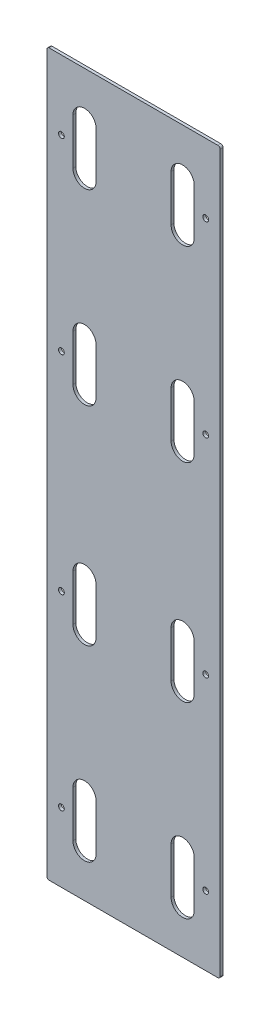
from build123d import *

# Parameters (mm, degrees)
SKETCH1_W                   = 190.5
SKETCH1_H                   = 793.115
BOSS_EXTRUDE1_DEPTH         = 3.175
F_1_4_0_25_DIAMETER_HOLE1_D = 6.35
F_1_1_DIAMETER_SLOT1_DEPTH  = 3.175
FILLET1_R                   = 2.54


# Read off the part's stored shape, not the designer's step: 1 (1) Diameter Slot1
with BuildPart() as part:
    # Sketch1 → Boss-Extrude1 (new body)
    with BuildSketch(Plane.XY):
        with Locations((95.25, 396.5575)):
            Rectangle(SKETCH1_W, SKETCH1_H)
    extrude(amount=BOSS_EXTRUDE1_DEPTH)

    # 1/4 (0.25) Diameter Hole1 (through all)
    with Locations(Plane.XY.offset(3.175)):
        with Locations((15.875, 716.915), (15.875, 510.8575), (15.875, 282.2575), (15.875, 76.2), (174.625, 76.2), (174.625, 282.2575), (174.625, 510.8575), (174.625, 716.915)):
            Hole(F_1_4_0_25_DIAMETER_HOLE1_D / 2)

    # 1 (1) Diameter Slot1 outline → 1 (1) Diameter Slot1 (cut)
    with BuildSketch(Plane.XY):
        with BuildLine():
            Line((161.925, 691.515), (161.925, 742.315))
            ThreePointArc((161.925, 742.315), (149.225, 755.015), (136.525, 742.315))
            Line((136.525, 742.315), (136.525, 691.515))
            ThreePointArc((136.525, 691.515), (149.225, 678.815), (161.925, 691.515))
        make_face()
        with BuildLine():
            ThreePointArc((161.925, 536.2575), (149.225, 548.9575), (136.525, 536.2575))
            Line((136.525, 536.2575), (136.525, 485.4575))
            ThreePointArc((136.525, 485.4575), (149.225, 472.7575), (161.925, 485.4575))
            Line((161.925, 485.4575), (161.925, 536.2575))
        make_face()
        with BuildLine():
            ThreePointArc((161.925, 307.6575), (149.225, 320.3575), (136.525, 307.6575))
            Line((136.525, 307.6575), (136.525, 256.8575))
            ThreePointArc((136.525, 256.8575), (149.225, 244.1575), (161.925, 256.8575))
            Line((161.925, 256.8575), (161.925, 307.6575))
        make_face()
        with BuildLine():
            ThreePointArc((161.925, 101.6), (149.225, 114.3), (136.525, 101.6))
            Line((136.525, 101.6), (136.525, 50.8))
            ThreePointArc((136.525, 50.8), (149.225, 38.1), (161.925, 50.8))
            Line((161.925, 50.8), (161.925, 101.6))
        make_face()
        with BuildLine():
            Line((53.975, 50.8), (53.975, 101.6))
            ThreePointArc((53.975, 101.6), (41.275, 114.3), (28.575, 101.6))
            Line((28.575, 101.6), (28.575, 50.8))
            ThreePointArc((28.575, 50.8), (41.275, 38.1), (53.975, 50.8))
        make_face()
        with BuildLine():
            ThreePointArc((53.975, 307.6575), (41.275, 320.3575), (28.575, 307.6575))
            Line((28.575, 307.6575), (28.575, 256.8575))
            ThreePointArc((28.575, 256.8575), (41.275, 244.1575), (53.975, 256.8575))
            Line((53.975, 256.8575), (53.975, 307.6575))
        make_face()
        with BuildLine():
            ThreePointArc((53.975, 536.2575), (41.275, 548.9575), (28.575, 536.2575))
            Line((28.575, 536.2575), (28.575, 485.4575))
            ThreePointArc((28.575, 485.4575), (41.275, 472.7575), (53.975, 485.4575))
            Line((53.975, 485.4575), (53.975, 536.2575))
        make_face()
        with BuildLine():
            ThreePointArc((53.975, 742.315), (41.275, 755.015), (28.575, 742.315))
            Line((28.575, 742.315), (28.575, 691.515))
            ThreePointArc((28.575, 691.515), (41.275, 678.815), (53.975, 691.515))
            Line((53.975, 691.515), (53.975, 742.315))
        make_face()
    extrude(amount=F_1_1_DIAMETER_SLOT1_DEPTH, mode=Mode.SUBTRACT)

    # Fillet1
    fillet1_edges = [part.edges().sort_by_distance(p)[0] for p in [
        (0, 793.115, 1.5875),
        (190.5, 793.115, 1.5875),
        (190.5, 0, 1.5875),
        (0, 0, 1.5875),
    ]]
    fillet(fillet1_edges, radius=FILLET1_R)


solid = part.part
